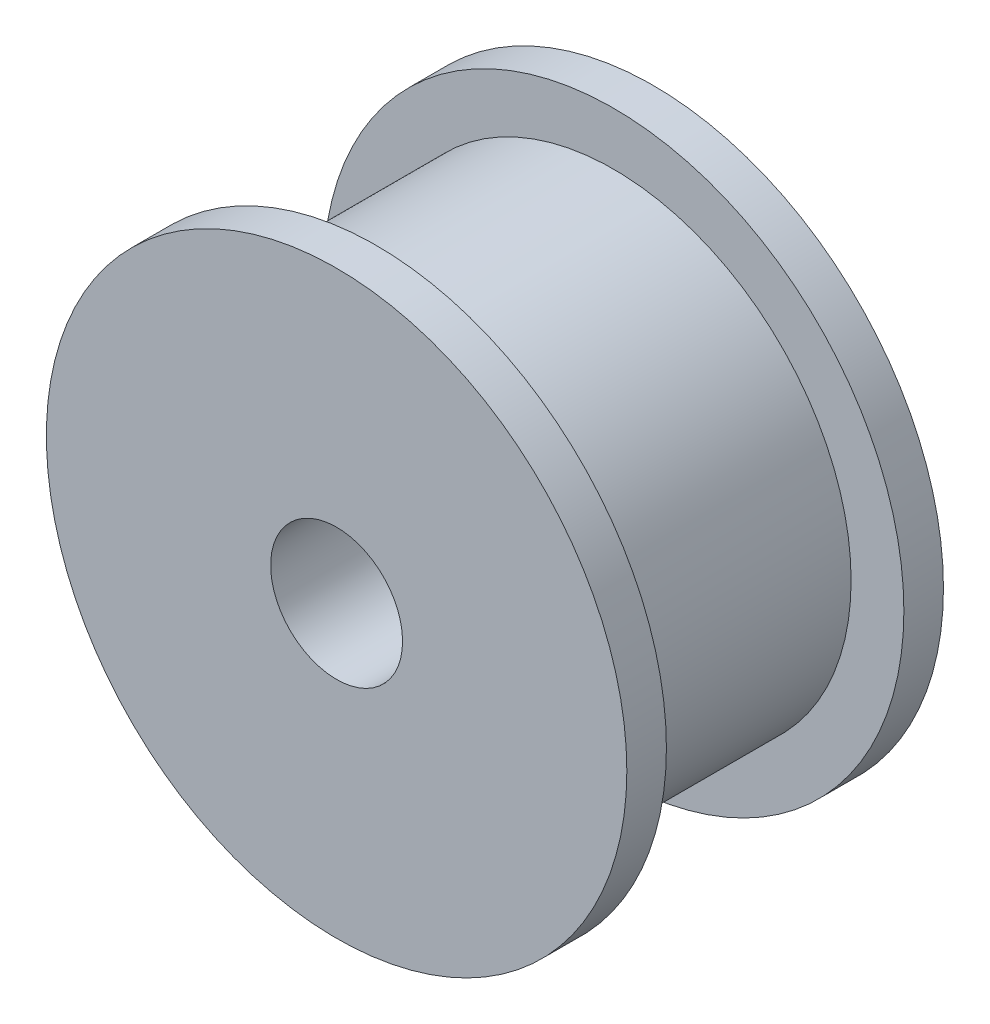
from build123d import *

# Parameters (mm, degrees)
ESQUISSE1_R                  = 11
BOSS_EXTRU_1_DEPTH           = 1.5
ESQUISSE2_R                  = 9
BOSS_EXTRU_2_DEPTH           = 9
ESQUISSE3_R                  = 11
BOSS_EXTRU_3_DEPTH           = 1.5
ENL_V_MAT_EXTRU_1_DEPTH      = 20.646882704
ENL_V_MAT_EXTRU_1_DEPTH_BACK = 20.646882704
ESQUISSE4_R                  = 2.5


with BuildPart() as part:
    # Esquisse1 → Boss.-Extru.1 (new body)
    with BuildSketch(Plane.XY):
        Circle(ESQUISSE1_R)
    extrude(amount=BOSS_EXTRU_1_DEPTH)

    # Esquisse2 → Boss.-Extru.2 (add)
    with BuildSketch(Plane.XY.offset(1.5)):
        Circle(ESQUISSE2_R)
    extrude(amount=BOSS_EXTRU_2_DEPTH)

    # Esquisse3 → Boss.-Extru.3 (add)
    with BuildSketch(Plane.XY.offset(10.5)):
        Circle(ESQUISSE3_R)
    extrude(amount=BOSS_EXTRU_3_DEPTH)

    # Esquisse4 → Enlèv. mat.-Extru.1 (cut, two sides: drawn at the far end of the back side and taken through both)
    with BuildSketch(Plane.XY.offset(12).offset(-ENL_V_MAT_EXTRU_1_DEPTH_BACK)):
        Circle(ESQUISSE4_R)
    extrude(amount=ENL_V_MAT_EXTRU_1_DEPTH + ENL_V_MAT_EXTRU_1_DEPTH_BACK, mode=Mode.SUBTRACT)


solid = part.part
